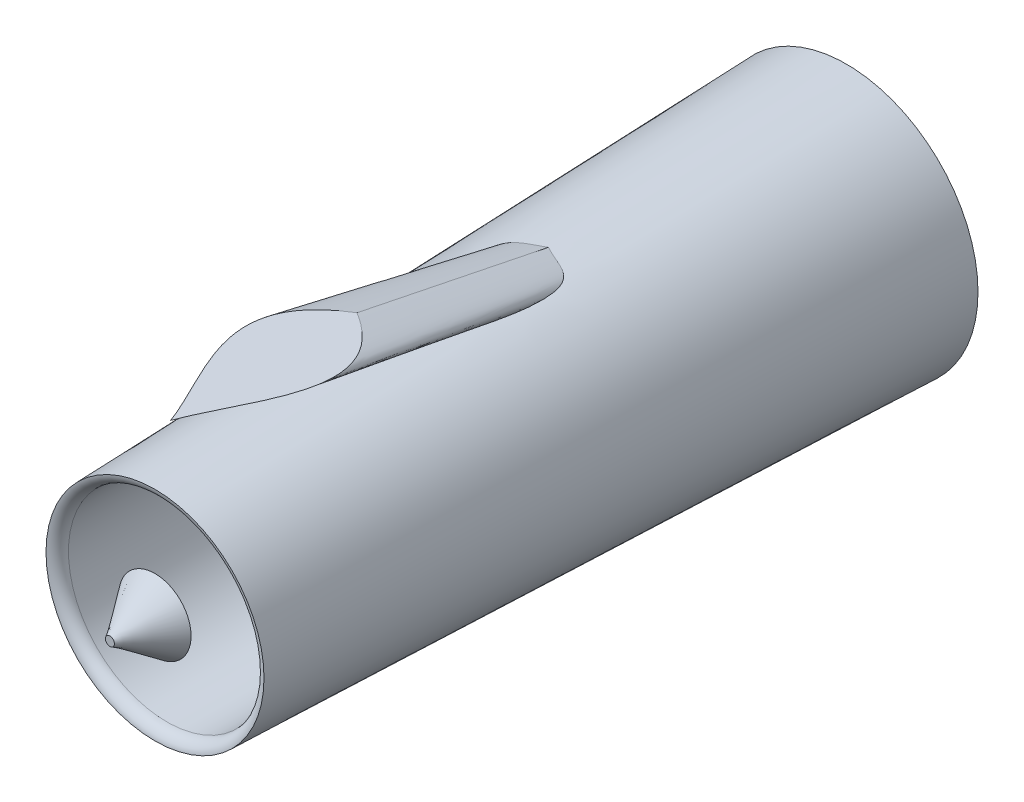
from build123d import *

# Parameters (mm, degrees)
SKETCH13_R              = 1333.5
SKETCH14_R              = 1104.9
CUT_EXTRUDE1_DEPTH      = 11079.167700467
CUT_EXTRUDE1_DEPTH_BACK = 11079.167700467
SKETCH16_R              = 998.22
FILLET1_R               = 304.8
FILLET2_R               = 121.92


with BuildPart() as part:
    # Sketch13 → Loft2 section 0
    with BuildSketch(Plane.XY.offset(-1555.524505737)):
        with Locations((-7141.464, 0)):
            Circle(SKETCH13_R)
    # Sketch14 → Loft2 section 1
    with BuildSketch(Plane.XY.offset(5453.224494263)):
        with Locations((-7141.464, 0)):
            Circle(SKETCH14_R)
    loft()

    # Sketch16 → Cut-Extrude1 (cut, two sides: drawn at the far end of the back side and taken through both)
    with BuildSketch(Plane(origin=(0, 0, -1555.524505737), x_dir=(-1, 0, 0), z_dir=(0, 0, -1)).offset(-CUT_EXTRUDE1_DEPTH_BACK)):
        with Locations(Location((7141.464, 0, 0), (0, 0, 180))):
            Circle(SKETCH16_R)
    extrude(amount=CUT_EXTRUDE1_DEPTH + CUT_EXTRUDE1_DEPTH_BACK, mode=Mode.SUBTRACT)

    # Fillet1
    fillet1_edges = [part.edges().sort_by_distance(p)[0] for p in [
        (-8139.684, 0, -1555.524505737),
    ]]
    fillet(fillet1_edges, radius=FILLET1_R)

    # Fillet2
    # the kernel refuses this fillet: 121.92 mm, written as the material it takes off along each edge
    with BuildSketch(Plane(origin=(-7141.464, 0, 5453.224494263), x_dir=(1, 0, 0), z_dir=(0, 1, 0))) as fillet2_piece_1:
        with BuildLine():
            CenterArc((1120.14, 120.963749942), FILLET2_R, 180, 82.819244219)
            Line((1104.9, 0), (1104.5952, -2.419274999))
            ThreePointArc((1104.5952, -2.419274999), (1051.56, -2.4384), (998.22, -2.4384))
            Line((998.22, -2.4384), (995.7816, 0))
            Line((995.7816, 0), (995.7816, 120.963749942))
            Line((995.7816, 120.963749942), (998.22, 120.963749942))
        make_face()
    revolve(axis=Axis((-7141.464, 0, 5453.224494263), (0, 0, -1)), mode=Mode.SUBTRACT)

    # Sketch20 → Loft4 section 0
    with BuildSketch(Plane(origin=(0, 1630.85143289, 0), x_dir=(1, 0, 0), z_dir=(0, 1, 0))):
        with BuildLine():
            add(Edge.make_bspline(
                [(-7141.464, -3406.150417238), (-6258.792679908, -3941.713353622), (-6917.015995223, -4684.307581352), (-7141.464, -5295.528257059)],
                knots=[0, 0, 0, 0, 1, 1, 1, 1], degree=3))
            add(Edge.make_bspline(
                [(-7141.464, -3406.150417238), (-8024.135320092, -3941.713353622), (-7365.912004777, -4684.307581352), (-7141.464, -5295.528257059)],
                knots=[0, 0, 0, 0, 1, 1, 1, 1], degree=3))
        make_face()
    # Sketch17 → Loft4 section 1
    with BuildSketch(Plane(origin=(0, 1097.45143289, 0), x_dir=(1, 0, 0), z_dir=(0, 1, 0))):
        with BuildLine():
            add(Edge.make_bspline(
                [(-7141.464, -790.775094263), (-6485.133228657, -1204.505671061), (-6910.377107034, -2338.077362285), (-7141.464, -2877.715495293)],
                knots=[0, 0, 0, 0, 1, 1, 1, 1], degree=3))
            add(Edge.make_bspline(
                [(-7141.464, -790.775094263), (-7797.794771343, -1204.505671061), (-7372.550892966, -2338.077362285), (-7141.464, -2877.715495293)],
                knots=[0, 0, 0, 0, 1, 1, 1, 1], degree=3))
        make_face()
    loft()


with BuildPart() as body_2:
    # Loft3: read off the stored shape, not the designer's step
    # Loft3: loft between two sections, ruled curve by curve
    loft3_from = [
        Edge.make_bspline([(-7186.546928673, 7.605783475, 5910.424494263), (-7171.335361724, 97.771640821, 5910.424494263), (-7081.169504378, 82.560073871, 5910.424494263), (-7096.381071327, -7.605783475, 5910.424494263), (-7111.592638276, -97.771640821, 5910.424494263), (-7201.758495622, -82.560073871, 5910.424494263), (-7186.546928673, 7.605783475, 5910.424494263)], [0, 0, 0, 0, 0.5, 0.5, 0.5, 1, 1, 1, 1], 3, [1, 0.333333333, 0.333333333, 1, 0.333333333, 0.333333333, 1]),
    ]
    loft3_to = [
        Edge.make_bspline([(-7375.668986618, 280.941990174, 5453.224494263), (-6813.78500627, 749.351963411, 5453.224494263), (-6345.375033033, 187.467983062, 5453.224494263), (-6907.259013382, -280.941990174, 5453.224494263), (-7469.14299373, -749.351963411, 5453.224494263), (-7937.552966967, -187.467983062, 5453.224494263), (-7375.668986618, 280.941990174, 5453.224494263)], [0, 0, 0, 0, 0.5, 0.5, 0.5, 1, 1, 1, 1], 3, [1, 0.333333333, 0.333333333, 1, 0.333333333, 0.333333333, 1]),
    ]
    loft3 = Solid(Shell([*[Face.make_surface_from_curves(loft3_from[k], loft3_to[k]) for k in range(1)], Face(Wire(loft3_from)), Face(Wire(loft3_to))]))
    add(loft3)


solid = Compound([part.part, body_2.part])
